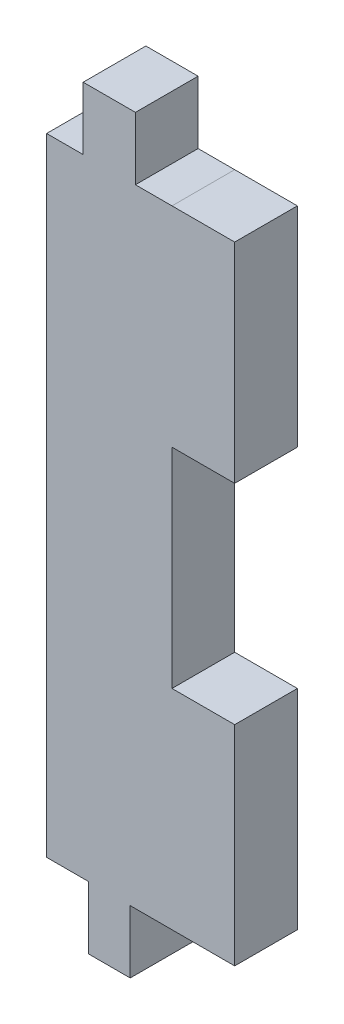
from build123d import *

# Parameters (mm, degrees)
SKETCH1_W           = 4.166666667
SKETCH1_H           = 5
SKETCH1_W_2         = 3.333333333
BOSS_EXTRUDE1_DEPTH = 5
CAVITY1_START       = -27.230031218
CAVITY1_OUTLINE_W   = 16.666666667
CAVITY1_OUTLINE_H   = 5
CAVITY1_DEPTH       = 5


# Read off the part's stored shape, not the designer's step: Cavity1
with BuildPart() as part:
    # Sketch1 → Boss-Extrude1 (new body)
    with BuildSketch(Plane.XY):
        with Locations((-32.230031219, -13.680003411)):
            Rectangle(SKETCH1_W, SKETCH1_H)
        Polygon((-34.313364552, -21.180003411), (-34.313364552, -16.180003411), (-37.230031218, -16.180003411), (-37.230031218, -66.180003411), (-33.896697885, -66.180003411), (-33.896697885, -61.180003411), (-30.563364552, -61.180003411), (-30.563364552, -66.180003411), (-27.230031218, -66.180003411), (-27.230031218, -16.180003411), (-30.146697885, -16.180003411), (-30.146697885, -21.180003411), align=None)
        with Locations((-32.230031219, -18.680003411)):
            Rectangle(SKETCH1_W, SKETCH1_H)
        Polygon((-22.230031218, -16.180335931), (-27.230031218, -16.180003411), (-27.230031218, -66.180003411), (-22.230031218, -66.180003411), align=None)
        with Locations((-32.230031219, -63.680003411)):
            Rectangle(SKETCH1_W_2, SKETCH1_H)
        with Locations((-32.230031219, -68.680003411)):
            Rectangle(SKETCH1_W_2, SKETCH1_H)
    extrude(amount=BOSS_EXTRUDE1_DEPTH)

    # Cavity1 outline → Cavity1 (cut)
    with BuildSketch(Plane.YZ.offset(CAVITY1_START)):
        with Locations((-41.180335932, 2.5)):
            Rectangle(CAVITY1_OUTLINE_W, CAVITY1_OUTLINE_H)
    extrude(amount=CAVITY1_DEPTH, mode=Mode.SUBTRACT)


solid = part.part
